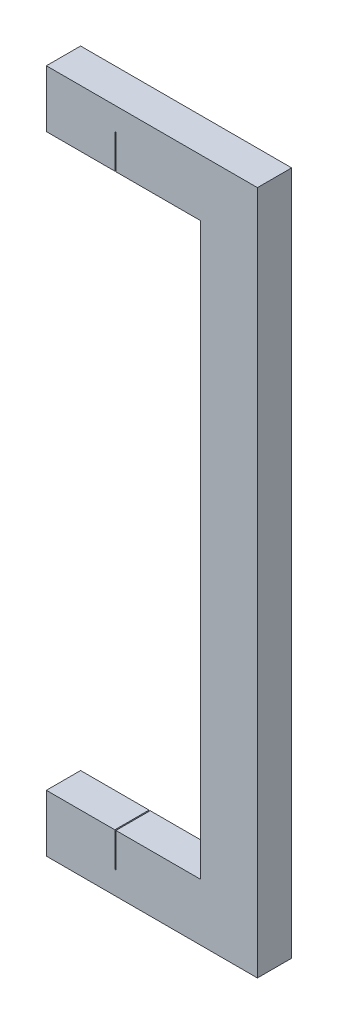
from build123d import *

# Parameters (mm, degrees)
BOSS_EXTRUDE1_DEPTH = 3
SKETCH2_W           = 0.1
SKETCH2_H           = 3
CUT_EXTRUDE1_DEPTH  = 3
SKETCH3_W           = 0.1
SKETCH3_H           = 3
CUT_EXTRUDE2_DEPTH  = 3


with BuildPart() as part:
    # Sketch1 → Boss-Extrude1 (new body)
    with BuildSketch(Plane.XY):
        Polygon((0, 0), (18.5, 0), (18.5, -60), (0, -60), (0, -55), (13.5, -55), (13.5, -5), (0, -5), align=None)
    extrude(amount=BOSS_EXTRUDE1_DEPTH)

    # Sketch2 → Cut-Extrude1 (cut)
    with BuildSketch(Plane(origin=(0, -55, 0), x_dir=(1, 0, 0), z_dir=(0, 1, 0))):
        with Locations((6.05, -1.5)):
            Rectangle(SKETCH2_W, SKETCH2_H)
    extrude(amount=-CUT_EXTRUDE1_DEPTH, mode=Mode.SUBTRACT)

    # Sketch3 → Cut-Extrude2 (cut)
    with BuildSketch(Plane.XZ.offset(5)):
        with Locations((6.05, 1.5)):
            Rectangle(SKETCH3_W, SKETCH3_H)
    extrude(amount=-CUT_EXTRUDE2_DEPTH, mode=Mode.SUBTRACT)


solid = part.part
